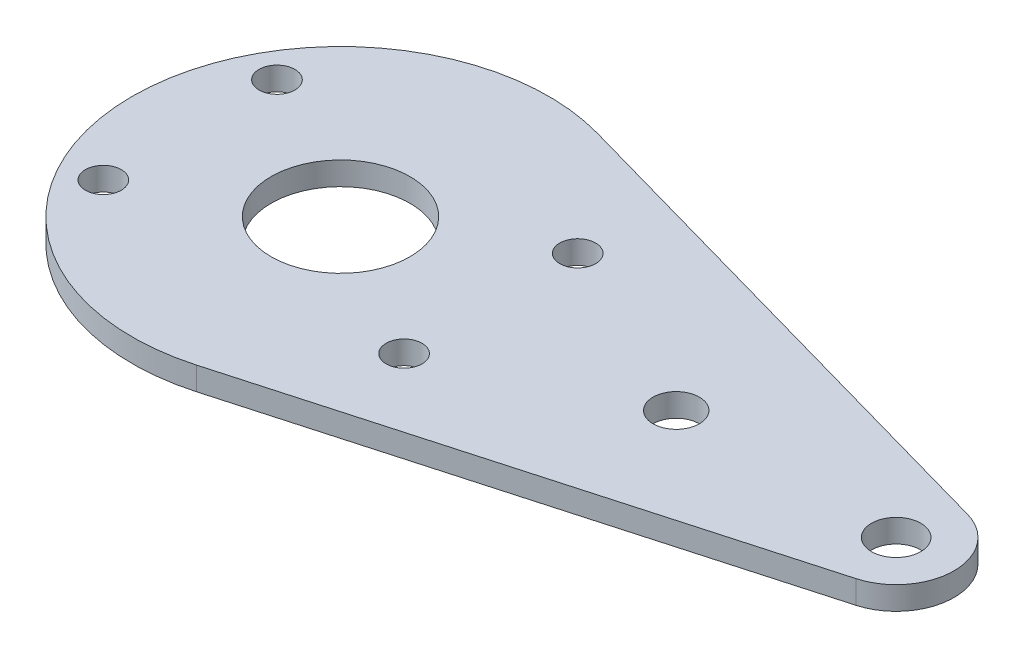
from build123d import *

# Parameters (mm, degrees)
SKETCH1_R                    = 3.3782
SKETCH1_R_2                  = 9.525
BOSS_EXTRUDE1_DEPTH          = 3.175
F_10_0_1935_DIAMETER_HOLE1_D = 4.9149
F_1_4_0_25_DIAMETER_HOLE2_D  = 6.35


with BuildPart() as part:
    # Sketch1 → Boss-Extrude1 (new body)
    with BuildSketch(Plane(origin=(0, 0, 0), x_dir=(1, 0, 0), z_dir=(0, 1, 0))):
        with BuildLine():
            Line((78.349739583, 7.640845894), (7.7390625, 27.507045218))
            ThreePointArc((7.7390625, 27.507045218), (-28.575, 0), (7.7390625, -27.507045218))
            Line((7.7390625, -27.507045218), (78.349739583, -7.640845894))
            ThreePointArc((78.349739583, -7.640845894), (84.1375, 0), (78.349739583, 7.640845894))
        make_face()
        with Locations((76.2, 0)):
            Circle(SKETCH1_R, mode=Mode.SUBTRACT)
        Circle(SKETCH1_R_2, mode=Mode.SUBTRACT)
    extrude(amount=BOSS_EXTRUDE1_DEPTH)

    # #10 (0.1935) Diameter Hole1 (through all)
    with Locations(Plane(origin=(0, 3.175, 0), x_dir=(1, 0, 0), z_dir=(0, 1, 0))):
        with Locations((-20.622229928, -11.90625), (-20.622229928, 11.90625), (20.622229928, 11.90625), (20.622229928, -11.90625)):
            Hole(F_10_0_1935_DIAMETER_HOLE1_D / 2)

    # 1/4 (0.25) Diameter Hole2 (through all)
    with Locations(Plane(origin=(0, 3.175, 0), x_dir=(1, 0, 0), z_dir=(0, 1, 0))):
        with Locations((46.0375, 0)):
            Hole(F_1_4_0_25_DIAMETER_HOLE2_D / 2)


solid = part.part
